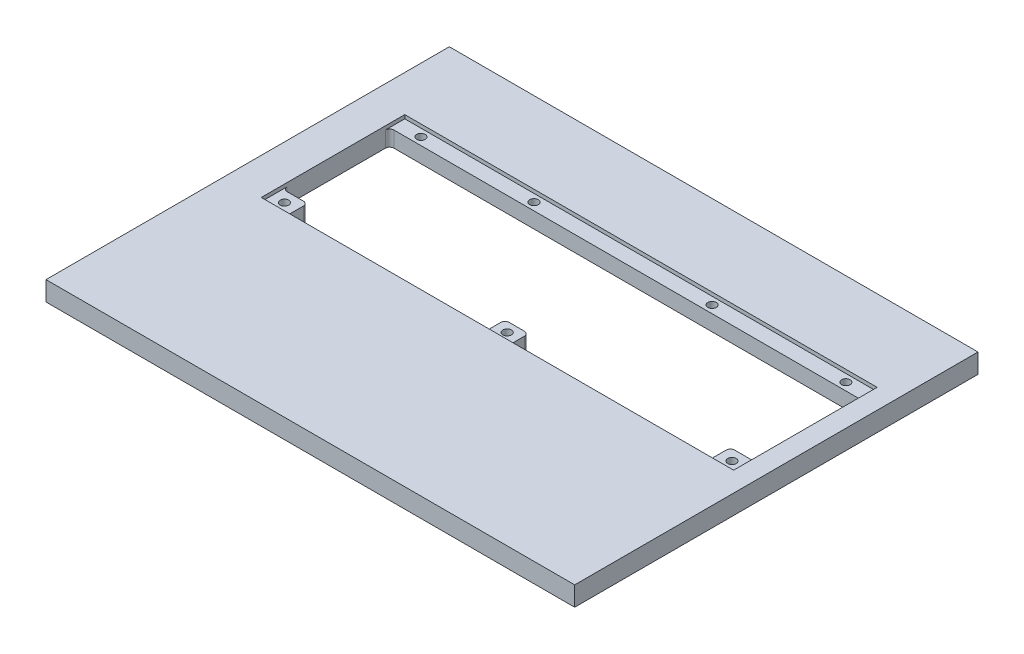
from build123d import *

# Parameters (mm, degrees)
SKETCH1_W           = 245
SKETCH1_H           = 186.9
BOSS_EXTRUDE1_DEPTH = 9
SKETCH2_W           = 218.9
SKETCH2_H           = 66.5
CUT_EXTRUDE1_DEPTH  = 9
SKETCH4_W           = 218.9
SKETCH4_H           = 7
SKETCH4_W_2         = 11.5
SKETCH4_H_2         = 10
SKETCH4_W_3         = 11
SKETCH4_H_3         = 9
BOSS_EXTRUDE2_DEPTH = 7.3
SKETCH3_R           = 2
CUT_EXTRUDE2_DEPTH  = 6.6
FILLET1_R           = 2


with BuildPart() as part:
    # Sketch1 → Boss-Extrude1 (new body)
    with BuildSketch(Plane(origin=(0, 0, 0), x_dir=(1, 0, 0), z_dir=(0, 1, 0))):
        with Locations((122.5, 93.45)):
            Rectangle(SKETCH1_W, SKETCH1_H)
    extrude(amount=BOSS_EXTRUDE1_DEPTH)

    # Sketch2 → Cut-Extrude1 (cut)
    with BuildSketch(Plane(origin=(0, 0, 0), x_dir=(1, 0, 0), z_dir=(0, 1, 0))):
        with Locations((126.36, 116.1)):
            Rectangle(SKETCH2_W, SKETCH2_H)
    extrude(amount=CUT_EXTRUDE1_DEPTH, mode=Mode.SUBTRACT)

    # Sketch4 → Boss-Extrude2 (add)
    with BuildSketch(Plane(origin=(0, 0, 0), x_dir=(1, 0, 0), z_dir=(0, 1, 0))):
        with Locations((126.36, 145.85)):
            Rectangle(SKETCH4_W, SKETCH4_H)
        with Locations((230.06, 87.85)):
            Rectangle(SKETCH4_W_2, SKETCH4_H_2)
        with Locations((126.36, 87.35)):
            Rectangle(SKETCH4_W_3, SKETCH4_H_3)
        with Locations((22.66, 87.85)):
            Rectangle(SKETCH4_W_2, SKETCH4_H_2)
    extrude(amount=BOSS_EXTRUDE2_DEPTH)

    # Sketch3 → Cut-Extrude2 (cut)
    with BuildSketch(Plane(origin=(0, 9, 0), x_dir=(1, 0, 0), z_dir=(0, 1, 0))):
        with Locations((27.91, 145.85)):
            Circle(SKETCH3_R)
        with Locations((80.31, 145.85)):
            Circle(SKETCH3_R)
        with Locations((162.81, 145.85)):
            Circle(SKETCH3_R)
        with Locations((224.81, 145.85)):
            Circle(SKETCH3_R)
        with Locations((22.66, 87.85)):
            Circle(SKETCH3_R)
        with Locations((126.36, 87.35)):
            Circle(SKETCH3_R)
        with Locations((230.06, 87.85)):
            Circle(SKETCH3_R)
    extrude(amount=-CUT_EXTRUDE2_DEPTH, mode=Mode.SUBTRACT)

    # Fillet1
    fillet1_edges = [part.edges().sort_by_distance(p)[0] for p in [
        (16.91, 3.65, -92.85),
        (28.41, 3.65, -82.85),
        (28.41, 3.65, -92.85),
        (16.91, 3.65, -142.35),
        (235.81, 3.65, -142.35),
        (235.81, 3.65, -92.85),
        (224.31, 3.65, -82.85),
        (224.31, 3.65, -92.85),
        (120.86, 3.65, -82.85),
        (131.86, 3.65, -82.85),
        (131.86, 3.65, -91.85),
        (120.86, 3.65, -91.85),
    ]]
    fillet(fillet1_edges, radius=FILLET1_R)


solid = part.part
